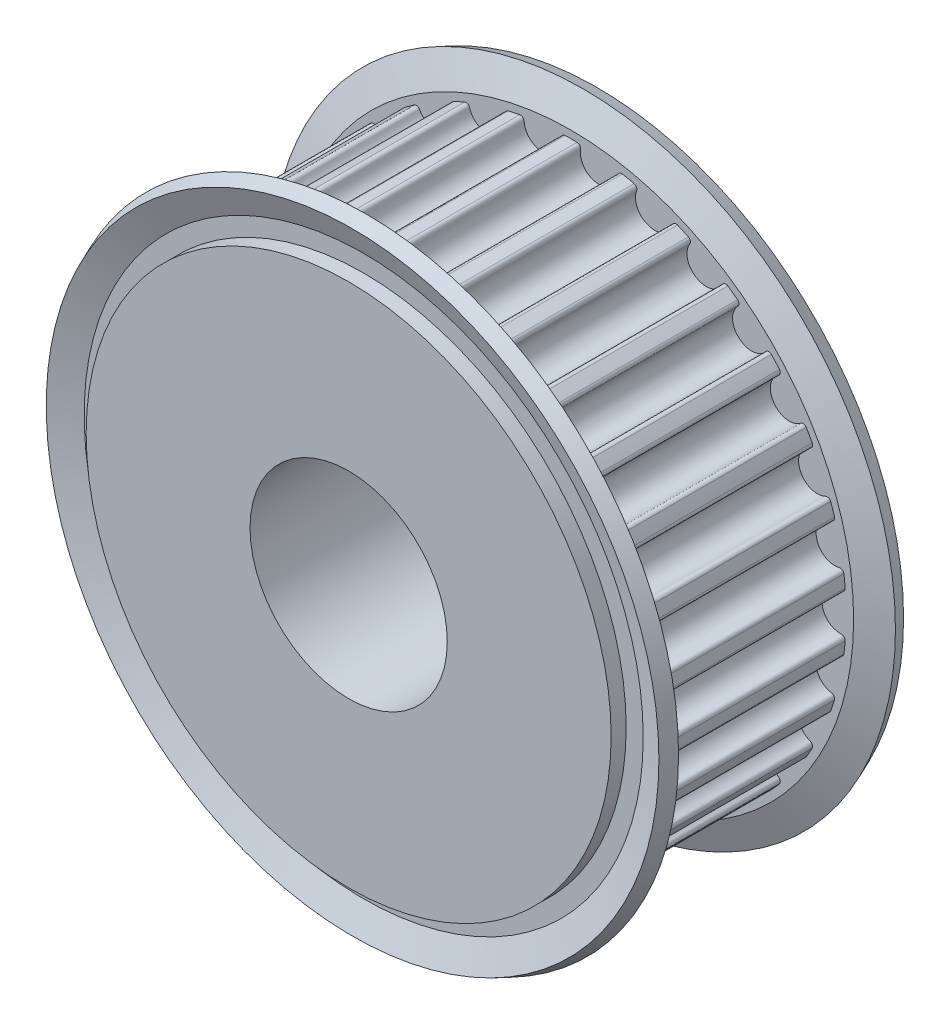
from build123d import *

# Parameters (mm, degrees)
TOOTHEXTRUDECUTGEARBELT01_DEPTH = 4.876799927
PATTERNGEARBELT01_COUNT         = 30
BOREREVOLVESKETCH_W             = 12.801599808
BOREREVOLVESKETCH_H             = 5


with BuildPart() as part:
    # SketchRevolveGearBelt01 → GearBelt01 (revolve)
    with BuildSketch(Plane(origin=(0, 0, 0), x_dir=(0, 0, -1), z_dir=(1, 0, 0))):
        Polygon((6.400799904, 0), (6.400799904, 13.306916417), (5.638799915, 13.306916417), (5.638799915, 14.17134518), (6.201536555, 15.529911608), (5.497540362, 15.821516379), (4.876799927, 14.322916402), (4.876799927, 13.941916408), (-4.876799927, 13.941916408), (-4.876799927, 14.322916402), (-5.497540362, 15.821516379), (-6.201536555, 15.529911608), (-5.638799915, 14.17134518), (-5.638799915, 13.306916417), (-6.400799904, 13.306916417), (-6.400799904, 0), align=None)
    revolve(axis=Axis((0, 0, 0), (0, 0, -1)))

    # SketchToothGearBelt01 → ToothExtrudeCutGearBelt01 (cut, symmetric)
    with BuildSketch(Plane.XY):
        with BuildLine():
            ThreePointArc((13.893477895, 1.162049767), (13.941990091, 0), (13.893477895, -1.162049767))
            add(Edge.make_bspline(
                [(13.893477895, -1.162049767), (13.894355497, -1.151569871), (13.894367328, -1.13574137), (13.891783851, -1.114849561), (13.88856033, -1.099393952), (13.884072736, -1.084256956), (13.878351699, -1.069541767), (13.871436211, -1.055348702), (13.863373419, -1.041774518), (13.854218288, -1.028911755), (13.844033233, -1.016848102), (13.832887687, -1.005665799), (13.820857633, -0.995441086), (13.808025082, -0.986243636), (13.794477517, -0.97813627), (13.780307299, -0.971173811), (13.765611019, -0.965405397), (13.750488906, -0.960864109), (13.735043897, -0.957604207), (13.719381867, -0.955560951), (13.690295039, -0.954660893), (13.642257342, -0.955570539), (13.575220239, -0.952960995), (13.502997829, -0.944194093), (13.431675895, -0.929863568), (13.361697972, -0.909971895), (13.293492773, -0.884664268), (13.227479874, -0.85409009), (13.164064907, -0.818438922), (13.10363766, -0.777929443), (13.046569525, -0.732810753), (12.993211261, -0.683360129), (12.943890814, -0.629881514), (12.898911329, -0.572703598), (12.858549229, -0.512177812), (12.823052703, -0.448676153), (12.792639493, -0.382588943), (12.767498123, -0.314322274), (12.747777154, -0.244296081), (12.733620052, -0.172939446), (12.725030771, -0.100695851), (12.723087585, -0.04755736), (12.723178891, -0.014000083), (12.723166194, 0), (12.723178891, 0.014000083), (12.723087585, 0.04755736), (12.725030771, 0.100695851), (12.733620052, 0.172939446), (12.747777154, 0.244296081), (12.767498123, 0.314322274), (12.792639493, 0.382588943), (12.823052703, 0.448676153), (12.858549229, 0.512177812), (12.898911329, 0.572703598), (12.943890814, 0.629881514), (12.993211261, 0.683360129), (13.046569525, 0.732810753), (13.10363766, 0.777929443), (13.164064907, 0.818438922), (13.227479874, 0.85409009), (13.293492773, 0.884664268), (13.361697972, 0.909971895), (13.431675895, 0.929863568), (13.502997829, 0.944194093), (13.575220239, 0.952960995), (13.642257342, 0.955570539), (13.690295039, 0.954660893), (13.719381867, 0.955560951), (13.735043897, 0.957604207), (13.750488906, 0.960864109), (13.765611019, 0.965405397), (13.780307299, 0.971173811), (13.794477517, 0.97813627), (13.808025082, 0.986243636), (13.820857633, 0.995441086), (13.832887687, 1.005665799), (13.844033233, 1.016848102), (13.854218288, 1.028911755), (13.863373419, 1.041774518), (13.871436211, 1.055348702), (13.878351699, 1.069541767), (13.884072736, 1.084256956), (13.88856033, 1.099393952), (13.891783851, 1.114849561), (13.894367328, 1.13574137), (13.894355497, 1.151569871), (13.893477895, 1.162049767)],
                knots=[0, 0, 0, 0, 0.008512506, 0.012768759, 0.017025012, 0.021281265, 0.025537518, 0.029793771, 0.034050023, 0.038306276, 0.042562529, 0.046818782, 0.051075035, 0.055331288, 0.059587541, 0.063843794, 0.068100047, 0.0723563, 0.076612553, 0.080868806, 0.085125059, 0.100157118, 0.119771414, 0.139385711, 0.159000007, 0.178614304, 0.1982286, 0.217842897, 0.237457193, 0.257071489, 0.276685786, 0.296300082, 0.315914379, 0.335528675, 0.355142972, 0.374757268, 0.394371565, 0.413985861, 0.433600158, 0.453214454, 0.472828751, 0.492443047, 0.496221523, 0.5, 0.503778477, 0.507556953, 0.527171249, 0.546785546, 0.566399842, 0.586014139, 0.605628435, 0.625242732, 0.644857028, 0.664471325, 0.684085621, 0.703699918, 0.723314214, 0.742928511, 0.762542807, 0.782157103, 0.8017714, 0.821385696, 0.840999993, 0.860614289, 0.880228586, 0.899842882, 0.914874941, 0.919131194, 0.923387447, 0.9276437, 0.931899953, 0.936156206, 0.940412459, 0.944668712, 0.948924965, 0.953181218, 0.957437471, 0.961693724, 0.965949977, 0.970206229, 0.974462482, 0.978718735, 0.982974988, 0.987231241, 0.991487494, 1, 1, 1, 1], degree=3))
        make_face()
    toothextrudecutgearbelt01 = extrude(amount=TOOTHEXTRUDECUTGEARBELT01_DEPTH, both=True, mode=Mode.SUBTRACT)

    # PatternGearBelt01: ToothExtrudeCutGearBelt01 ×30 about axis
    patterngearbelt01_axis = Axis((0, 0, 55), (0, 0, -1))
    for i in range(1, PATTERNGEARBELT01_COUNT):
        add(toothextrudecutgearbelt01.rotate(patterngearbelt01_axis, i * 360 / PATTERNGEARBELT01_COUNT), mode=Mode.SUBTRACT)

    # BoreRevolveSketch → BoreRevolveCut (revolve, cut)
    with BuildSketch(Plane(origin=(0, 0, 0), x_dir=(0, 0, -1), z_dir=(1, 0, 0))):
        with Locations((0, 2.5)):
            Rectangle(BOREREVOLVESKETCH_W, BOREREVOLVESKETCH_H)
    revolve(axis=Axis((0, 0, 0), (0, 0, -1)), mode=Mode.SUBTRACT)


solid = part.part
